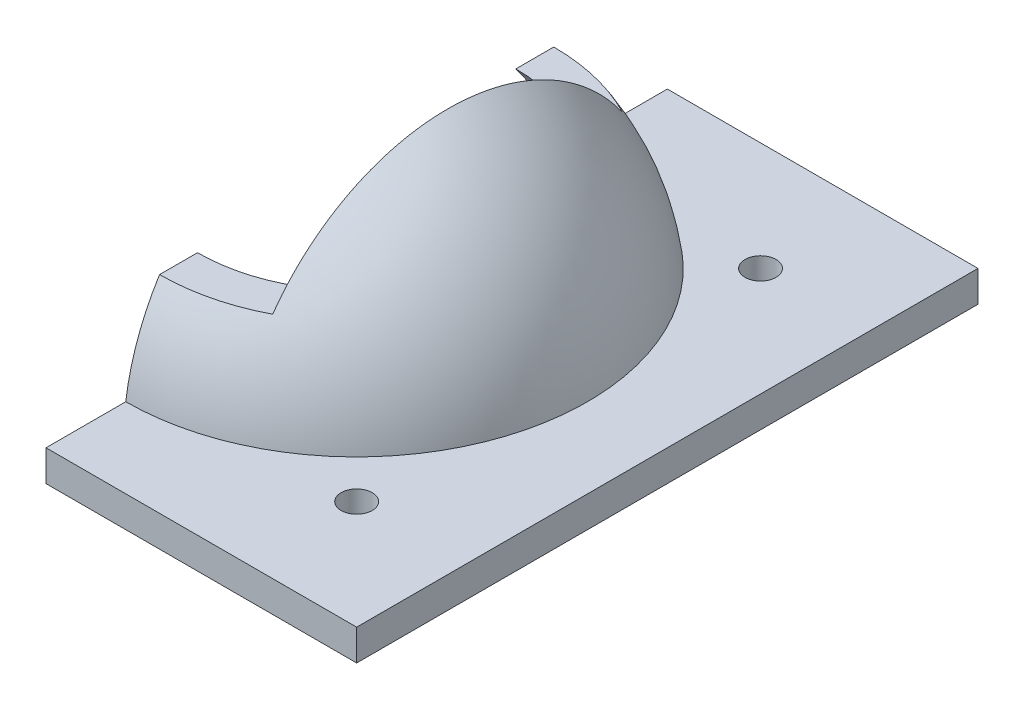
from build123d import *

# Parameters (mm, degrees)
SKETCH2_W            = 14.859
SKETCH2_H            = 12.608842622
CUT_EXTRUDE1_DEPTH   = 63.5
SKETCH3_W            = 50.8
SKETCH3_H            = 50.8
SKETCH3_R            = 16.51
BOSS_EXTRUDE1_DEPTH  = 2.54
SKETCH5_R            = 1.27
CUT_EXTRUDE3_DEPTH   = 39.927698273
LPATTERN1_COUNT      = 2
LPATTERN1_PITCH      = 33.02
LPATTERN1_COUNT_DIR2 = 2
LPATTERN1_PITCH_DIR2 = 33.02
SKETCH7_W            = 55.925579977
SKETCH7_H            = 24.805472435
CUT_EXTRUDE4_DEPTH   = 25.4


with BuildPart() as part:
    # Sketch1 → Revolve1 (revolve)
    with BuildSketch(Plane.XY):
        with BuildLine():
            Line((19.05, 0), (16.51, 0))
            ThreePointArc((16.51, 0), (11.674332957, 11.674332957), (0, 16.51))
            Line((0, 16.51), (0, 19.05))
            ThreePointArc((0, 19.05), (13.470384182, 13.470384182), (19.05, 0))
        make_face()
    revolve(axis=Axis((0, 19.05, 0), (0, -1, 0)))

    # Sketch2 → Cut-Extrude1 (cut, symmetric)
    with BuildSketch(Plane.XY):
        with Locations((0, 16.464421311)):
            Rectangle(SKETCH2_W, SKETCH2_H)
    extrude(amount=CUT_EXTRUDE1_DEPTH, both=True, mode=Mode.SUBTRACT)

    # Sketch3 → Boss-Extrude1 (add)
    with BuildSketch(Plane.XZ):
        Rectangle(SKETCH3_W, SKETCH3_H)
        Circle(SKETCH3_R, mode=Mode.SUBTRACT)
    extrude(amount=-BOSS_EXTRUDE1_DEPTH)

    # Sketch5 → Cut-Extrude3 (cut, through all)
    with BuildSketch(Plane(origin=(0, 2.54, 0), x_dir=(1, 0, 0), z_dir=(0, 1, 0))):
        with Locations((-16.51, 16.51)):
            Circle(SKETCH5_R)
    cut_extrude3 = extrude(amount=-CUT_EXTRUDE3_DEPTH, mode=Mode.SUBTRACT)

    # LPattern1: Cut-Extrude3 2 × 2
    with Locations(*[(i * LPATTERN1_PITCH, 0, j * LPATTERN1_PITCH_DIR2) for i in range(LPATTERN1_COUNT) for j in range(LPATTERN1_COUNT_DIR2) if (i, j) != (0, 0)]):
        add(cut_extrude3, mode=Mode.SUBTRACT)

    # Sketch7 → Cut-Extrude4 (cut)
    with BuildSketch(Plane.ZY.offset(25.4)):
        with Locations((-0.382276116, 9.761847735)):
            Rectangle(SKETCH7_W, SKETCH7_H)
    extrude(amount=-CUT_EXTRUDE4_DEPTH, mode=Mode.SUBTRACT)


solid = part.part
